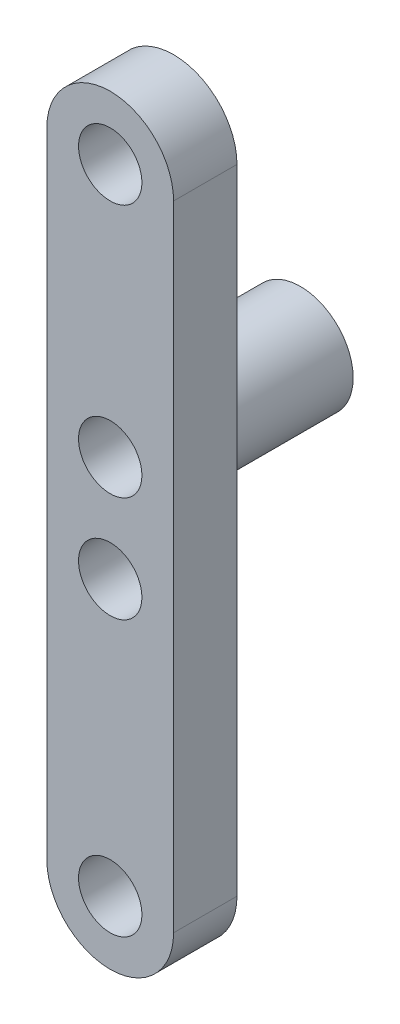
from build123d import *

# Parameters (mm, degrees)
SKETCH_1_R      = 1.5
EXTRUDE_1_DEPTH = 3
SKETCH_3_R      = 2.5
SKETCH_3_R_2    = 1.5
EXTRUDE_2_DEPTH = 6


with BuildPart() as part:
    # ｽｹｯﾁ1 → ﾎﾞｽ - 押し出し1 (new body)
    with BuildSketch(Plane.XY):
        with BuildLine():
            Line((-3, 0), (-3, -30))
            ThreePointArc((-3, -30), (0, -33), (3, -30))
            Line((3, -30), (3, 0))
            ThreePointArc((3, 0), (0, 3), (-3, 0))
        make_face()
        Circle(SKETCH_1_R, mode=Mode.SUBTRACT)
        with Locations((0, -30)):
            Circle(SKETCH_1_R, mode=Mode.SUBTRACT)
        with Locations((0, -17)):
            Circle(SKETCH_1_R, mode=Mode.SUBTRACT)
        with Locations((0, -12)):
            Circle(SKETCH_1_R, mode=Mode.SUBTRACT)
    extrude(amount=EXTRUDE_1_DEPTH)


with BuildPart() as body_2:
    # ｽｹｯﾁ3 → ﾎﾞｽ - 押し出し2 (new body)
    with BuildSketch(Plane.XY):
        with Locations((0, -12)):
            Circle(SKETCH_3_R)
        with Locations((0, -12)):
            Circle(SKETCH_3_R_2, mode=Mode.SUBTRACT)
    extrude(amount=-EXTRUDE_2_DEPTH)


solid = Compound([part.part, body_2.part])
